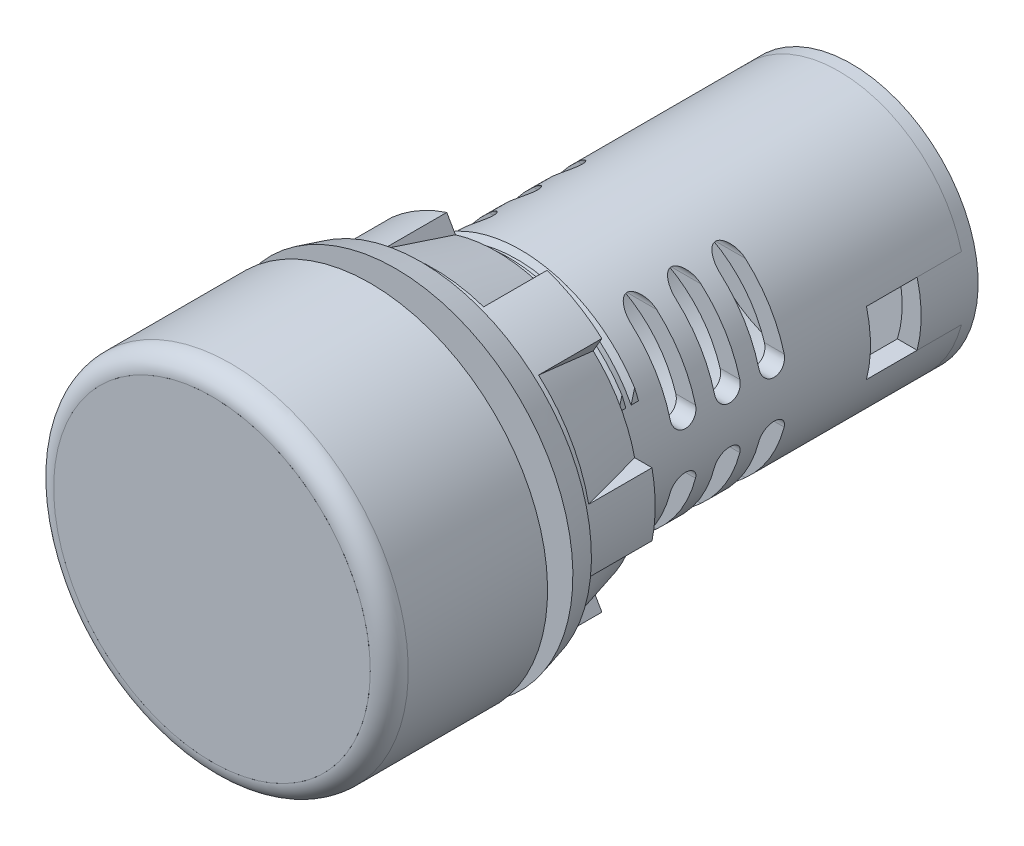
from build123d import *
from build123d.topology import SkipClean

# Parameters (mm, degrees)
VACIADO1_T                 = -1.5
CORTAR_EXTRUIR1_DEPTH      = 54.31275644721439
CORTAR_EXTRUIR1_DEPTH_BACK = 54.31275644721439
CROQUIS14_R                = 10.000000000000004
CROQUIS14_R_2              = 2.4999999999999947
CROQUIS14_R_3              = 2.499999999999994
SALIENTE_EXTRUIR3_DEPTH    = 1
SALIENTE_EXTRUIR4_DEPTH    = 3.5
SALIENTE_EXTRUIR1_START    = 2.5
SALIENTE_EXTRUIR1_DEPTH    = 2.5
BARRER1_PITCH              = 0.9999999999999979
CORTAR_EXTRUIR3_DEPTH      = 43.848570636603505
CROQUIS11_R                = 12.5
SALIENTE_EXTRUIR2_DEPTH    = 7.5
VACIADO5_T                 = -1.5
REDONDEO1_R                = 1.5
CROQUIS15_R                = 14.000000000000007
CROQUIS15_R_2              = 10.000000000000005
SALIENTE_EXTRUIR6_DEPTH    = 2
SALIENTE_EXTRUIR7_START    = 6
CROQUIS16_R                = 12.500000000000009
CROQUIS16_R_2              = 10.000000000000004
SALIENTE_EXTRUIR7_DEPTH    = 6
CHAFL_N1_SIZE              = 2
CHAFL_N1_SIZE_2            = 0.535898385
CHAFL_N2_SIZE              = 5
CHAFL_N2_SIZE2             = 1.339745962155617
SALIENTE_EXTRUIR9_START    = 6
SALIENTE_EXTRUIR9_DEPTH    = 6


with BuildPart() as part:
    # Croquis1 → Revolución1 (revolve)
    with BuildSketch(Plane(origin=(0, 0, 0), x_dir=(0, 0, -1), z_dir=(1, 0, 0))):
        Polygon((12.499999999999998, 10.000000000000007), (49.49999999999999, 10.000000000000007), (49.5, 5.45e-15), (0, 0), (-6.94e-15, 14), (12.499999999999996, 14.000000000000009), align=None)
    revolve(axis=Axis((0, 5.45e-15, -49.5), (0, -1.1e-16, 1)))

    # Vaciado1
    vaciado1_openings = [part.faces().sort_by_distance(p)[0] for p in [
        (0, 0, 0),
    ]]
    offset(amount=VACIADO1_T, openings=vaciado1_openings, kind=Kind.INTERSECTION)

    # Croquis2 → Cortar-Extruir1 (cut, two sides: drawn at the far end of the back side and taken through both)
    with BuildSketch(Plane(origin=(0, 0, 0), x_dir=(0, 0, -1), z_dir=(1, 0, 0)).offset(-CORTAR_EXTRUIR1_DEPTH_BACK)):
        with BuildLine():
            Line((31.999999999999964, 7.500000000000042), (31.999999999999964, 2.500000000000041))
            ThreePointArc((31.999999999999964, 2.500000000000041), (30.999999999999968, 1.5000000000000955), (30.00000000000002, 2.5000000000000404))
            Line((30.00000000000002, 2.5000000000000404), (30.00000000000002, 7.500000000000042))
            ThreePointArc((30.00000000000002, 7.500000000000042), (30.999999999999968, 8.500000000000036), (31.999999999999964, 7.500000000000042))
        make_face()
        with BuildLine():
            Line((35.49999999999998, 7.50000000000004), (35.49999999999998, 2.500000000000042))
            ThreePointArc((35.49999999999998, 2.500000000000042), (34.49999999999997, 1.5000000000000706), (33.5, 2.5000000000000417))
            Line((33.5, 2.5000000000000417), (33.5, 7.50000000000004))
            ThreePointArc((33.5, 7.50000000000004), (34.49999999999997, 8.500000000000046), (35.49999999999998, 7.50000000000004))
        make_face()
        with BuildLine():
            Line((35.500000000000064, -2.4999999999999605), (35.500000000000064, -7.499999999999958))
            ThreePointArc((35.500000000000064, -7.499999999999958), (34.50000000000007, -8.500000000000114), (33.499999999999915, -7.499999999999958))
            Line((33.499999999999915, -7.499999999999958), (33.499999999999915, -2.499999999999961))
            ThreePointArc((33.499999999999915, -2.499999999999961), (34.50000000000007, -1.4999999999999676), (35.500000000000064, -2.4999999999999605))
        make_face()
        Polygon((49.49999999999999, 2.5000000000000004), (41.99999999999999, 2.499999999999999), (41.99999999999999, -2.500000000000001), (49.49999999999999, -2.4999999999999996), align=None)
        with BuildLine():
            Line((28.49999999999997, 7.500000000000015), (28.49999999999997, 2.5000000000000178))
            ThreePointArc((28.49999999999997, 2.5000000000000178), (27.499999999999968, 1.5000000000000675), (26.500000000000018, 2.5000000000000173))
            Line((26.500000000000018, 2.5000000000000173), (26.500000000000018, 7.500000000000015))
            ThreePointArc((26.500000000000018, 7.500000000000015), (27.499999999999968, 8.500000000000018), (28.49999999999997, 7.500000000000015))
        make_face()
        with BuildLine():
            Line((28.500000000000075, -2.499999999999985), (28.500000000000075, -7.499999999999982))
            ThreePointArc((28.500000000000075, -7.499999999999982), (27.500000000000075, -8.500000000000146), (26.49999999999991, -7.499999999999982))
            Line((26.49999999999991, -7.499999999999982), (26.49999999999991, -2.4999999999999853))
            ThreePointArc((26.49999999999991, -2.4999999999999853), (27.500000000000075, -1.499999999999985), (28.500000000000075, -2.499999999999985))
        make_face()
        with BuildLine():
            Line((32.00000000000007, -2.4999999999999605), (32.00000000000007, -7.499999999999958))
            ThreePointArc((32.00000000000007, -7.499999999999958), (31.00000000000007, -8.500000000000114), (29.999999999999915, -7.499999999999958))
            Line((29.999999999999915, -7.499999999999958), (29.999999999999915, -2.499999999999961))
            ThreePointArc((29.999999999999915, -2.499999999999961), (31.00000000000007, -1.4999999999999605), (32.00000000000007, -2.4999999999999605))
        make_face()
    extrude(amount=CORTAR_EXTRUIR1_DEPTH + CORTAR_EXTRUIR1_DEPTH_BACK, mode=Mode.SUBTRACT)

    # Croquis4 → Saliente-Extruir1 (add)
    with BuildSketch(Plane(origin=(0, 5.12e-15, -46.5), x_dir=(-1, 0, 0), z_dir=(0, 7e-17, -1)).offset(SALIENTE_EXTRUIR1_START)):
        with BuildLine():
            ThreePointArc((8.124038404635964, -2.5000000000000058), (8.500000000000005, -5.6e-15), (8.124038404635968, 2.499999999999995))
            ThreePointArc((8.124038404635968, 2.499999999999995), (-1.37e-15, 8.500000000000005), (-8.124038404635968, 2.499999999999995))
            ThreePointArc((-8.124038404635968, 2.499999999999995), (-8.500000000000005, -2.68e-15), (-8.124038404635964, -2.5000000000000053))
            ThreePointArc((-8.124038404635964, -2.5000000000000053), (5.2e-16, -8.500000000000005), (8.124038404635964, -2.5000000000000058))
        make_face()
    extrude(amount=-SALIENTE_EXTRUIR1_DEPTH)

    # Barrer1: arcs per turn and ends read off the stored shape
    # Barrer1: the profile of Croquis9 profile screwed along a right-hand helix through 12 turns, 8 arcs to a turn; built about Z, then put on its axis
    barrer1_z = Axis((0, 0, 0), (0, 0, 1))
    barrer1_corners = [(9.9997, 0, -0.250173205), (10.5, 0, 0.038675135), (9.9997, 0, 0.327523474)]
    with BuildLine(mode=Mode.PRIVATE) as barrer1_profile:
        Line(barrer1_corners[0], barrer1_corners[1])
        Line(barrer1_corners[1], barrer1_corners[2])
        Line(barrer1_corners[2], barrer1_corners[0])
    barrer1_cap = Face(barrer1_profile.wire())
    barrer1_turn_angles = [0, 22.5, 45, 67.5, 90, 112.5, 135, 157.5, 180, 202.5, 225, 247.5, 270, 292.5, 315, 337.5, 360]
    barrer1_turn_weights = [1, 0.9238795325112867, 1, 0.9238795325112867, 1, 0.9238795325112867, 1, 0.9238795325112867, 1, 0.9238795325112867, 1, 0.9238795325112867, 1, 0.9238795325112867, 1, 0.9238795325112867, 1]
    barrer1_turn_rails = [Edge.make_bspline([Vector(p[0], p[1], 0).rotate(barrer1_z, barrer1_turn_angles[k]) / barrer1_turn_weights[k] + Vector(0, 0, p[2] + BARRER1_PITCH * barrer1_turn_angles[k] / 360) for k in range(17)], [0, 0, 0, 1, 1, 2, 2, 3, 3, 4, 4, 5, 5, 6, 6, 7, 7, 8, 8, 8], 2, barrer1_turn_weights) for p in barrer1_corners]
    barrer1_turn_sides = [Face.make_surface_from_curves(barrer1_turn_rails[p[0]], barrer1_turn_rails[p[1]]) for p in [(0, 1), (1, 2), (2, 0)]]
    barrer1 = Plane(origin=(0, -3.04e-15, -24.499999999999996), x_dir=(1, -3.49e-15, 0), z_dir=(0, -7e-17, 1)) * Solid(Shell([*[p.moved(Location((0, 0, BARRER1_PITCH * i))) for i in range(12) for p in barrer1_turn_sides], barrer1_cap, barrer1_cap.rotate(barrer1_z, 4320).moved(Location((0, 0, BARRER1_PITCH * 4320 / 360)))]))
    add(barrer1)

    # Croquis10 → Cortar-Extruir3 (cut, through all)
    with BuildSketch(Plane(origin=(0, 1.38e-15, -12.499999999999998), x_dir=(-1, 0, 0), z_dir=(0, 7e-17, -1))):
        with BuildLine():
            Line((-8.999999999999998, -6), (-8.999999999999998, -4.358898943540685))
            ThreePointArc((-8.999999999999998, -4.358898943540685), (-9.999999999999996, -6.23e-15), (-8.999999999999998, 4.358898943540672))
            Line((-8.999999999999998, 4.358898943540672), (-8.999999999999998, 6))
            Line((-8.999999999999998, 6), (-10.999999999999998, 6))
            Line((-10.999999999999998, 6), (-10.999999999999998, -6))
            Line((-10.999999999999998, -6), (-8.999999999999998, -6))
        make_face()
        with BuildLine():
            Line((8.999999999999998, 6), (10.999999999999998, 6))
            Line((10.999999999999998, 6), (10.999999999999998, -6))
            Line((10.999999999999998, -6), (8.999999999999998, -6))
            Line((8.999999999999998, -6), (8.999999999999998, -4.358898943540685))
            ThreePointArc((8.999999999999998, -4.358898943540685), (9.999999999999996, -5.79e-15), (8.999999999999998, 4.358898943540672))
            Line((8.999999999999998, 4.358898943540672), (8.999999999999998, 6))
        make_face()
    extrude(amount=CORTAR_EXTRUIR3_DEPTH, mode=Mode.SUBTRACT)

    # Redondeo1
    redondeo1_edges = [part.edges().sort_by_distance(p)[0] for p in [
        (-1.71e-15, -14, 5.56e-15),
    ]]
    fillet(redondeo1_edges, radius=REDONDEO1_R - 0.0001)  # a hair under: the kernel refuses the full size


with BuildPart() as body_2:
    # Croquis14 → Saliente-Extruir3 (new body)
    # profile 1 of 3: a face of its own
    with BuildSketch(Plane(origin=(0, 5.45e-15, -49.5), x_dir=(-1, 0, 0), z_dir=(0, 7e-17, -1))):
        Circle(CROQUIS14_R)
        with Locations((-5, 5.2e-16)):
            Circle(CROQUIS14_R_2, mode=Mode.SUBTRACT)
        with Locations((5, 2.3e-16)):
            Circle(CROQUIS14_R_3, mode=Mode.SUBTRACT)
    # profile 2 of 3: a face of its own
    with BuildSketch(Plane(origin=(0, 5.45e-15, -49.5), x_dir=(-1, 0, 0), z_dir=(0, 7e-17, -1))):
        with BuildLine():
            Line((9.682458365518547, 2.4999999999999942), (8.124038404635968, 2.4999999999999942))
            ThreePointArc((8.124038404635968, 2.4999999999999942), (8.500000000000005, -5.95e-15), (8.124038404635964, -2.5000000000000058))
            Line((8.124038404635964, -2.5000000000000058), (9.682458365518544, -2.5000000000000058))
            ThreePointArc((9.682458365518544, -2.5000000000000058), (10.000000000000004, -5.84e-15), (9.682458365518547, 2.4999999999999942))
        make_face()
    # profile 3 of 3: a face of its own
    with BuildSketch(Plane(origin=(0, 5.45e-15, -49.5), x_dir=(-1, 0, 0), z_dir=(0, 7e-17, -1))):
        with BuildLine():
            Line((-9.682458365518544, -2.5000000000000058), (-8.124038404635964, -2.5000000000000058))
            ThreePointArc((-8.124038404635964, -2.5000000000000058), (-8.500000000000007, -3.02e-15), (-8.12403840463597, 2.4999999999999942))
            Line((-8.12403840463597, 2.4999999999999942), (-9.68245836551855, 2.4999999999999942))
            ThreePointArc((-9.68245836551855, 2.4999999999999942), (-10.000000000000005, -3.51e-15), (-9.682458365518544, -2.5000000000000058))
        make_face()
    extrude(amount=SALIENTE_EXTRUIR3_DEPTH)

    # Croquis14<4> → Saliente-Extruir4 (add)
    with SkipClean():  # the faces are left unmerged after this step: merging them gives an invalid solid
        with BuildSketch(Plane(origin=(0, 5.45e-15, -49.5), x_dir=(-1, 0, 0), z_dir=(0, 7e-17, -1))):
            with BuildLine():
                Line((-8.12403840463597, 2.4999999999999942), (-9.68245836551855, 2.4999999999999942))
                ThreePointArc((-9.682458365518547, 2.4999999999999947), (-10.000000000000004, -7.95e-15), (-9.682458365518546, -2.5000000000000058))
                Line((-9.682458365518544, -2.5000000000000058), (-8.124038404635964, -2.5000000000000058))
                ThreePointArc((-8.124038404635963, -2.5000000000000058), (-8.500000000000007, -6.77e-15), (-8.12403840463597, 2.4999999999999942))
            make_face()
            with BuildLine():
                ThreePointArc((10.000000000000004, -2.9e-16), (9.92029696267167, 1.2600429248272784), (9.682458365518547, 2.4999999999999947))
                Line((9.682458365518547, 2.4999999999999942), (8.124038404635968, 2.4999999999999942))
                ThreePointArc((8.124038404635968, 2.499999999999995), (8.500000000000005, -5.88e-15), (8.124038404635964, -2.5000000000000058))
                Line((8.124038404635964, -2.5000000000000058), (9.682458365518544, -2.5000000000000058))
                ThreePointArc((9.682458365518546, -2.5000000000000053), (9.92029696267167, -1.2600429248272806), (10.000000000000004, -2.74e-15))
            make_face()
        extrude(amount=-SALIENTE_EXTRUIR4_DEPTH)


with BuildPart() as body_3:
    # Croquis11 → Saliente-Extruir2 (new body)
    with BuildSketch(Plane.XY):
        Circle(CROQUIS11_R)
    extrude(amount=-SALIENTE_EXTRUIR2_DEPTH)

    # Vaciado5
    vaciado5_openings = [body_3.faces().sort_by_distance(p)[0] for p in [
        (0, 0, -7.5),
    ]]
    offset(amount=VACIADO5_T, openings=vaciado5_openings, kind=Kind.INTERSECTION)


with BuildPart() as body_4:
    # Croquis15 → Saliente-Extruir6 (new body)
    with BuildSketch(Plane(origin=(0, 1.6e-15, -14.499999999999998), x_dir=(-1, 0, 0), z_dir=(0, 7e-17, -1))):
        with Locations(Location((0, -5.74e-15, 0), (0, 0, 90))):
            Circle(CROQUIS15_R)
        with Locations(Location((0, 1.06e-15, 0), (0, 0, 90))):
            Circle(CROQUIS15_R_2, mode=Mode.SUBTRACT)
    extrude(amount=SALIENTE_EXTRUIR6_DEPTH)

    # Croquis16 → Saliente-Extruir7 (add)
    with BuildSketch(Plane(origin=(0, 1.18e-15, -16.5), x_dir=(-1, 0, 0), z_dir=(0, 7e-17, -1)).offset(SALIENTE_EXTRUIR7_START)):
        with Locations(Location((0, -5.74e-15, 0), (0, 0, 90))):
            Circle(CROQUIS16_R)
        with Locations(Location((0, 1.62e-15, 0), (0, 0, 90))):
            Circle(CROQUIS16_R_2, mode=Mode.SUBTRACT)
    extrude(amount=-SALIENTE_EXTRUIR7_DEPTH)

    # Chaflán1
    # the kernel refuses this chamfer: 2, 0.535898385 mm, written as the material it takes off along each edge
    with BuildSketch(Plane(origin=(0, -4e-15, -16.5), x_dir=(-6e-17, 1, 0), z_dir=(-1, -6e-17, 0))) as chafl_n1_piece_1:
        Polygon((14.000000000000007, -CHAFL_N1_SIZE), (14.000000000000007 - CHAFL_N1_SIZE_2, -3.55e-15), (14.000000000000007, -3.55e-15), align=None)
    revolve(axis=Axis((0, -4e-15, -16.5), (0, 7e-17, -1)), mode=Mode.SUBTRACT)

    # Chaflán2
    chafl_n2_edges = [body_4.edges().sort_by_distance(p)[0] for p in [
        (2.3e-15, -12.500000000000012, -22.5),
    ]]
    chafl_n2_side = [body_4.faces().sort_by_distance(p)[0] for p in [
        (2.3e-15, -12.500000000000012, -19.5),
    ]]
    chamfer(chafl_n2_edges, length=CHAFL_N2_SIZE, length2=CHAFL_N2_SIZE2, reference=chafl_n2_side[0])

    # Croquis20 → Saliente-Extruir9 (add)
    with BuildSketch(Plane(origin=(0, 1.18e-15, -16.5), x_dir=(-1, 0, 0), z_dir=(0, 7e-17, -1)).offset(SALIENTE_EXTRUIR9_START)):
        with BuildLine():
            Line((-3.958660847496834, 11.85660171779823), (-3.2732558584415785, 10.66944545299333))
            ThreePointArc((-3.2732558584415785, 10.66944545299333), (-5.580127018922186, 9.665063509461113), (-7.603382877363777, 8.169445452993338))
            Line((-7.603382877363777, 8.169445452993338), (-8.28878786641903, 9.356601717798236))
            ThreePointArc((-8.28878786641903, 9.356601717798236), (-6.249999999999987, 10.825317547305504), (-3.958660847496834, 11.85660171779823))
        make_face()
        with BuildLine():
            Line((-12.247448713915897, -2.5000000000000058), (-10.876638735805383, -2.5000000000000067))
            ThreePointArc((-10.876638735805383, -2.5000000000000067), (-11.160254037844396, -4.37e-15), (-10.876638735805384, 2.4999999999999933))
            Line((-10.876638735805384, 2.4999999999999933), (-12.247448713915901, 2.4999999999999933))
            ThreePointArc((-12.247448713915901, 2.4999999999999933), (-12.50000000000001, -4.21e-15), (-12.247448713915897, -2.5000000000000058))
        make_face()
        with BuildLine():
            Line((8.288787866419085, 9.35660171779819), (7.6033828773638215, 8.169445452993294))
            ThreePointArc((7.6033828773638215, 8.169445452993294), (5.580127018922237, 9.665063509461081), (3.2732558584416385, 10.669445452993312))
            Line((3.2732558584416385, 10.669445452993312), (3.9586608474969025, 11.856601717798206))
            ThreePointArc((3.9586608474969025, 11.856601717798206), (6.25000000000005, 10.825317547305467), (8.288787866419085, 9.35660171779819))
        make_face()
        with BuildLine():
            Line((12.247448713915883, -2.500000000000078), (10.876638735805367, -2.5000000000000684))
            ThreePointArc((10.876638735805367, -2.5000000000000684), (11.160254037844393, -7.048e-14), (10.8766387358054, 2.4999999999999316))
            Line((10.8766387358054, 2.4999999999999316), (12.247448713915915, 2.499999999999921))
            ThreePointArc((12.247448713915915, 2.499999999999921), (12.500000000000007, -8.033e-14), (12.247448713915883, -2.500000000000078))
        make_face()
        with BuildLine():
            Line((3.9586608474967493, -11.856601717798256), (3.273255858441502, -10.669445452993351))
            ThreePointArc((3.273255858441502, -10.669445452993351), (5.580127018922112, -9.665063509461152), (7.6033828773637175, -8.16944545299339))
            Line((7.6033828773637175, -8.16944545299339), (8.288787866418962, -9.356601717798293))
            ThreePointArc((8.288787866418962, -9.356601717798293), (6.249999999999909, -10.825317547305545), (3.9586608474967493, -11.856601717798256))
        make_face()
        with BuildLine():
            Line((-8.288787866419153, -9.356601717798128), (-7.603382877363881, -8.169445452993237))
            ThreePointArc((-7.603382877363881, -8.169445452993237), (-5.580127018922305, -9.665063509461042), (-3.2732558584417157, -10.669445452993287))
            Line((-3.2732558584417157, -10.669445452993287), (-3.9586608474969878, -11.856601717798174))
            ThreePointArc((-3.9586608474969878, -11.856601717798174), (-6.250000000000131, -10.825317547305419), (-8.288787866419153, -9.356601717798128))
        make_face()
    extrude(amount=-SALIENTE_EXTRUIR9_DEPTH)


solid = Compound([part.part, body_2.part, body_3.part, body_4.part])
